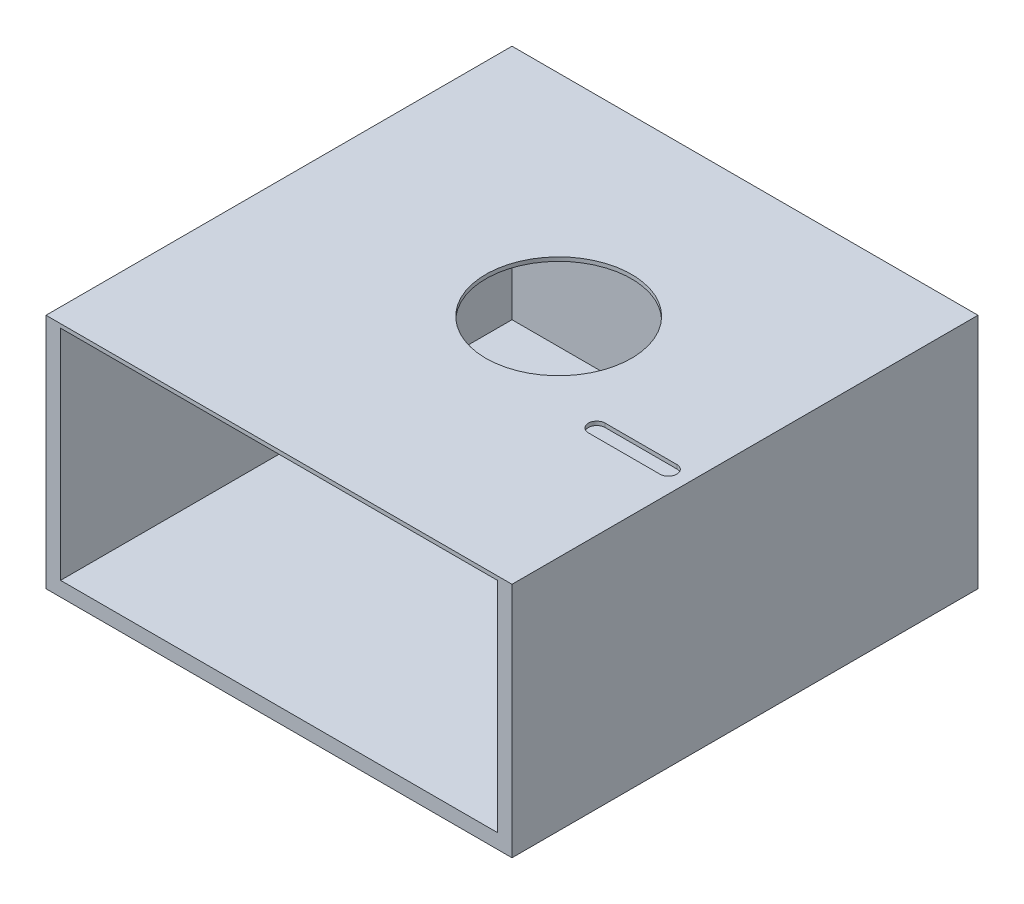
from build123d import *

# Parameters (mm, degrees)
SKETCH1_W           = 304.8
SKETCH1_H           = 152.4
BOSS_EXTRUDE1_DEPTH = 304.8
SHELL1_T            = -9.525
BOSS_EXTRUDE2_DEPTH = 2.54
SKETCH4_R           = 47.625
CUT_EXTRUDE1_DEPTH  = 7.62
CUT_EXTRUDE3_DEPTH  = 2.54


with BuildPart() as part:
    # Sketch1 → Boss-Extrude1 (new body)
    with BuildSketch(Plane.XY):
        Rectangle(SKETCH1_W, SKETCH1_H)
    extrude(amount=BOSS_EXTRUDE1_DEPTH)

    # Shell1
    shell1_openings = [part.faces().sort_by_distance(p)[0] for p in [
        (0, 0, 304.8),
        (0, 76.2, 152.4),
    ]]
    offset(amount=SHELL1_T, openings=shell1_openings, kind=Kind.INTERSECTION)

    # Sketch2 → Boss-Extrude2 (add)
    with BuildSketch(Plane(origin=(0, 76.2, 0), x_dir=(1, 0, 0), z_dir=(0, 1, 0))):
        Polygon((-142.875, -304.8), (142.875, -304.8), (152.4, -304.8), (152.4, 0), (-152.4, 0), (-152.4, -304.8), align=None)
    extrude(amount=BOSS_EXTRUDE2_DEPTH)

    # Sketch4 → Cut-Extrude1 (cut)
    with BuildSketch(Plane(origin=(0, 78.74, 0), x_dir=(1, 0, 0), z_dir=(0, 1, 0))):
        with Locations((15.875, -137.740097985)):
            Circle(SKETCH4_R)
    extrude(amount=-CUT_EXTRUDE1_DEPTH, mode=Mode.SUBTRACT)

    # Sketch9 → Cut-Extrude3 (cut)
    with BuildSketch(Plane(origin=(0, 78.74, 0), x_dir=(1, 0, 0), z_dir=(0, 1, 0))):
        with BuildLine():
            Line((138.437451516, -194.04995316), (91.580762502, -194.04995316))
            ThreePointArc((91.580762502, -194.04995316), (86.070907327, -188.540097985), (91.580762502, -183.03024281))
            Line((91.580762502, -183.03024281), (138.437451516, -183.03024281))
            ThreePointArc((138.437451516, -183.03024281), (143.947306691, -188.540097985), (138.437451516, -194.04995316))
        make_face()
    extrude(amount=-CUT_EXTRUDE3_DEPTH, mode=Mode.SUBTRACT)


solid = part.part
